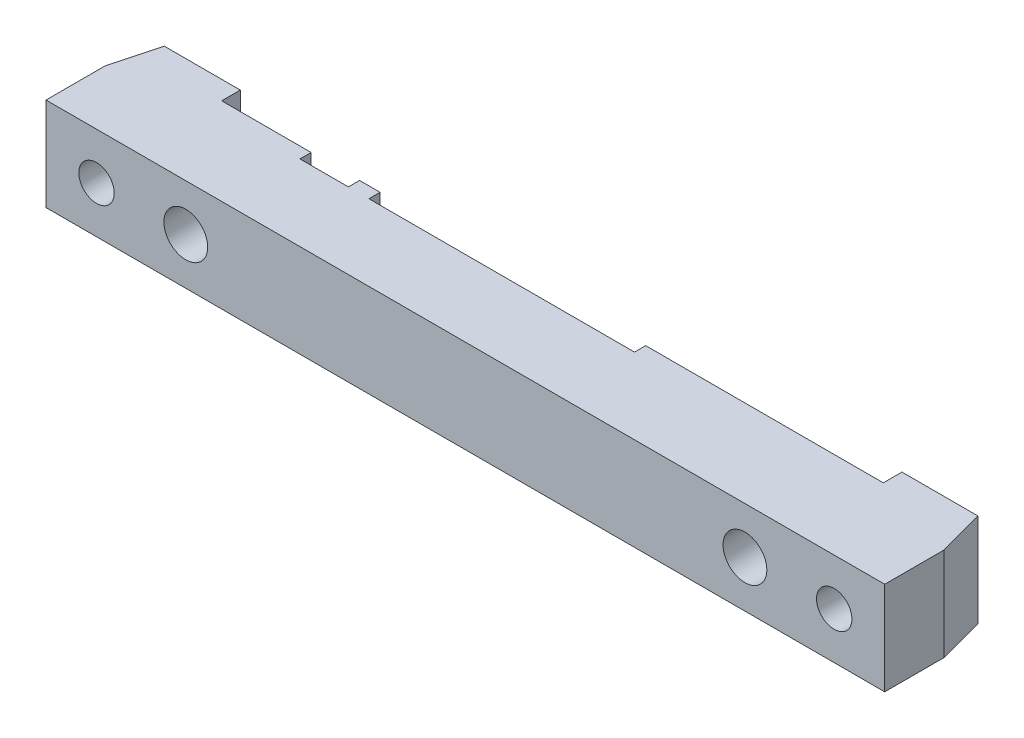
from build123d import *
from OCP.BRepFilletAPI import BRepFilletAPI_MakeChamfer

# Parameters (mm, degrees)
SKETCH2_W                       = 90
SKETCH2_H                       = 10
BOSS_EXTRUDE1_DEPTH             = 9.35
SKETCH4_W                       = 9.5
SKETCH4_H                       = 10
BOSS_EXTRUDE2_DEPTH             = 2
SKETCH5_R                       = 1.45
BOSS_EXTRUDE3_DEPTH             = 2.8
CHAMFER1_SIZE                   = 0.8
CHAMFER2_SIZE                   = 5
CHAMFER2_SIZE2                  = 1.339745962
F_13_0_185_DIAMETER_HOLE1_D     = 4.699
F_13_0_185_DIAMETER_HOLE1_DEPTH = 6.35
F_6_CLEARANCE_HOLE1_D           = 3.7973
F_6_CLEARANCE_HOLE1_ON_FACE_2_D = 3.7973
F_13_0_185_DIAMETER_HOLE2_D     = 4.699
F_13_0_185_DIAMETER_HOLE2_DEPTH = 6.35
F_6_CLEARANCE_HOLE2_D           = 3.7973
CUT_EXTRUDE1_DEPTH              = 92.035281622
CUT_EXTRUDE1_DEPTH_BACK         = 1.2
SKETCH12_W                      = 28.5
SKETCH12_H                      = 10
SKETCH12_W_2                    = 5.2
SKETCH12_H_2                    = 2
SKETCH12_W_3                    = 2.7
SKETCH12_H_3                    = 0.5


with BuildPart() as part:
    # Sketch2 → Boss-Extrude1 (new body)
    with BuildSketch(Plane.XY):
        with Locations((45, 5)):
            Rectangle(SKETCH2_W, SKETCH2_H)
    extrude(amount=BOSS_EXTRUDE1_DEPTH)

    # Sketch4 → Boss-Extrude2 (add)
    with BuildSketch(Plane(origin=(0, 0, 0), x_dir=(-1, 0, 0), z_dir=(0, 0, -1))):
        with Locations((-4.75, 5)):
            Rectangle(SKETCH4_W, SKETCH4_H)
        with Locations((-85.25, 5)):
            Rectangle(SKETCH4_W, SKETCH4_H)
    extrude(amount=BOSS_EXTRUDE2_DEPTH)

    # Sketch5 → Boss-Extrude3 (add)
    with BuildSketch(Plane(origin=(0, 0, 0), x_dir=(-1, 0, 0), z_dir=(0, 0, -1))):
        with Locations(Location((-69.137406388, 2.998839673, 0), (0, 0, 180))):
            Circle(SKETCH5_R)
        with Locations(Location((-20.877406388, 1.728839673, 0), (0, 0, 180))):
            Circle(SKETCH5_R)
    extrude(amount=BOSS_EXTRUDE3_DEPTH)

    # Chamfer1
    # the kernel refuses this chamfer: 0.8 mm, written as the material it adds along each edge
    with BuildSketch(Plane(origin=(69.137406388, 2.998839673, 0), x_dir=(1, 0, 0), z_dir=(0, 1, 0))) as chamfer1_piece_1:
        Polygon((1.45 + CHAMFER1_SIZE, 0), (1.45, CHAMFER1_SIZE), (1.45, 0), align=None)
    revolve(axis=Axis((69.137406388, 2.998839673, 0), (0, 0, -1)))
    with BuildSketch(Plane(origin=(20.877406388, 1.728839673, 0), x_dir=(1, 0, 0), z_dir=(0, 1, 0))) as chamfer1_piece_2_section:
        Polygon((1.45 + CHAMFER1_SIZE, 0), (1.45, CHAMFER1_SIZE), (1.45, 0), align=None)
    chamfer1_piece_2 = revolve(axis=Axis((20.877406388, 1.728839673, 0), (0, 0, -1)), mode=Mode.PRIVATE)
    chamfer1_piece_2 = split(chamfer1_piece_2, bisect_by=Plane(origin=(19.038199604, 0, -0.389206784), z_dir=(0, 1, 0)), keep=Keep.TOP, mode=Mode.PRIVATE)
    add(chamfer1_piece_2)

    # Chamfer2: one chamfer whose edges measure the first distance from different faces: ONE call of the kernel's chamfer builder (chamfer() names one face for all edges)
    chamfer2_edges_1 = [part.edges().sort_by_distance(p)[0] for p in [
        (0, 5, -2),
    ]]
    chamfer2_side_1 = [part.faces().sort_by_distance(p)[0] for p in [
        (0, 5, 3.675),
    ]]
    chamfer2_edges_2 = [part.edges().sort_by_distance(p)[0] for p in [
        (90, 5, -2),
    ]]
    chamfer2_side_2 = [part.faces().sort_by_distance(p)[0] for p in [
        (90, 5, 3.675),
    ]]
    chamfer2 = BRepFilletAPI_MakeChamfer(part.part.solid().wrapped)
    for e in chamfer2_edges_1:
        chamfer2.Add(CHAMFER2_SIZE, CHAMFER2_SIZE2, e.wrapped, chamfer2_side_1[0].wrapped)  # the first distance lies on this face
    for e in chamfer2_edges_2:
        chamfer2.Add(CHAMFER2_SIZE, CHAMFER2_SIZE2, e.wrapped, chamfer2_side_2[0].wrapped)  # the first distance lies on this face
    add(Compound.cast(chamfer2.Shape()), mode=Mode.REPLACE)

    # #13 (0.185) Diameter Hole1
    with Locations(Plane(origin=(84.580127019, 5, -2), x_dir=(-1, 0, 0), z_dir=(0, 0, -1))):
        with Locations((0, 0), (79.160254038, 0)):
            Hole(F_13_0_185_DIAMETER_HOLE1_D / 2, depth=F_13_0_185_DIAMETER_HOLE1_DEPTH)

    # #6 Clearance Hole1 (through all)
    with Locations(Plane(origin=(84.580127019, 5, 4.35), x_dir=(-1, 0, 0), z_dir=(0, 0, -1))):
        with Locations((0, 0), (79.160254038, 0)):
            Hole(F_6_CLEARANCE_HOLE1_D / 2)

    # #6 Clearance Hole1 on face 2 (through all)
    with Locations(Plane(origin=(5.419872981, 5, 0), x_dir=(-1, 0, 0), z_dir=(0, 0, -1))):
        with Locations((0, 0)):
            Hole(F_6_CLEARANCE_HOLE1_ON_FACE_2_D / 2)

    # #13 (0.185) Diameter Hole2
    with Locations(Plane(origin=(75, 5, 9.35), x_dir=(1, 0, 0), z_dir=(0, 0, 1))):
        with Locations((0, 0), (-60, 0)):
            Hole(F_13_0_185_DIAMETER_HOLE2_D / 2, depth=F_13_0_185_DIAMETER_HOLE2_DEPTH)

    # #6 Clearance Hole2 (through all)
    with Locations(Plane(origin=(75, 5, 3), x_dir=(1, 0, 0), z_dir=(0, 0, 1))):
        with Locations((0, 0), (-60, 0)):
            Hole(F_6_CLEARANCE_HOLE2_D / 2)

    # Sketch12 → Cut-Extrude1 (cut, two sides: drawn at the far end of the back side and taken through both)
    with BuildSketch(Plane(origin=(0, 0, 0), x_dir=(-1, 0, 0), z_dir=(0, 0, -1)).offset(-CUT_EXTRUDE1_DEPTH_BACK)):
        with Locations((-40.75, 5)):
            Rectangle(SKETCH12_W, SKETCH12_H)
        with Locations((-21.7, 9)):
            Rectangle(SKETCH12_W_2, SKETCH12_H_2)
        with Locations((-69.15, 0.25)):
            Rectangle(SKETCH12_W_3, SKETCH12_H_3)
    extrude(amount=CUT_EXTRUDE1_DEPTH + CUT_EXTRUDE1_DEPTH_BACK, mode=Mode.SUBTRACT)


solid = part.part
